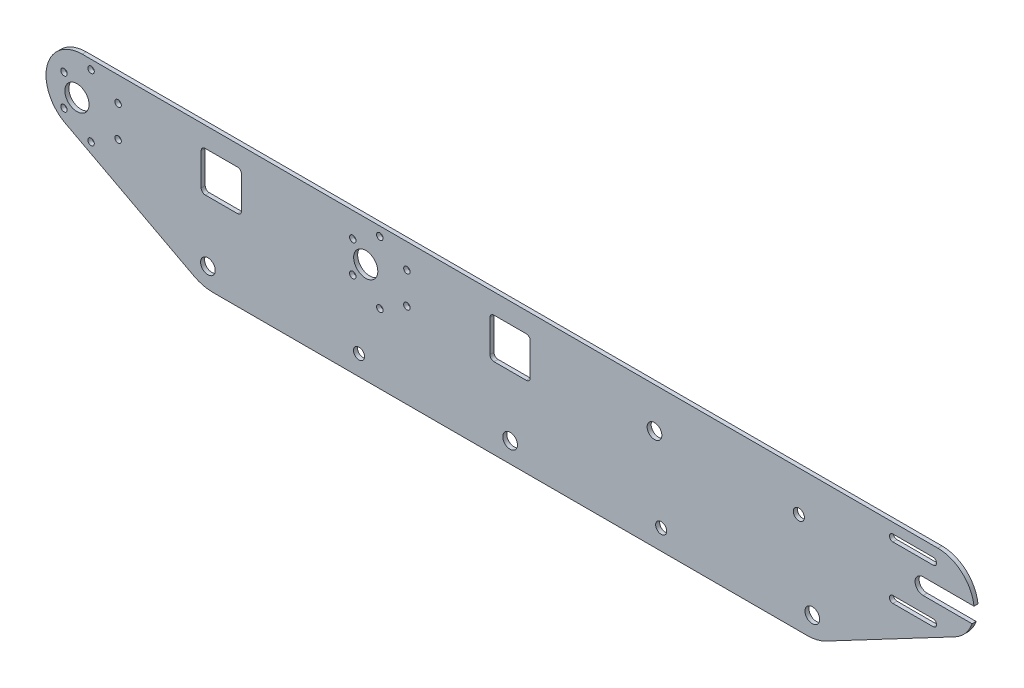
from build123d import *

# Parameters (mm, degrees)
ESQUISSE1_R             = 6
ESQUISSE1_R_2           = 3.65
BOSS_EXTRU_1_DEPTH      = 2
CONG_1_R                = 18
CONG_2_R                = 20
D_GAGEMENT_M32_D        = 3.4
ESQUISSE4_R             = 3.65
ENL_V_MAT_EXTRU_1_DEPTH = 234.819122898
ENL_V_MAT_EXTRU_2_DEPTH = 234.819122898
ESQUISSE8_R             = 1.6
ENL_V_MAT_EXTRU_3_DEPTH = 234.819122898
D_GAGEMENT_M51_D        = 5.5
D_GAGEMENT_M52_D        = 5.5
ESQUISSE13_W            = 20
ESQUISSE13_H            = 20
ENL_V_MAT_EXTRU_4_DEPTH = 234.819122898
CONG_3_R                = 2


with BuildPart() as part:
    # Esquisse1 → Boss.-Extru.1 (new body)
    with BuildSketch(Plane.XY):
        Polygon((-284.958991582, 40), (-247.300009613, 40), (248.333273954, 40), (284.958991582, 40), (248.333273954, 20.647569508), (152.479495791, -30), (-152.479495791, -30), (-247.300009613, 20.10160952), align=None)
        with Locations((-215, 20)):
            Circle(ESQUISSE1_R, mode=Mode.SUBTRACT)
        with Locations((-150, -20)):
            Circle(ESQUISSE1_R_2, mode=Mode.SUBTRACT)
        with Locations((150, -20)):
            Circle(ESQUISSE1_R_2, mode=Mode.SUBTRACT)
        with Locations((215, 20)):
            Circle(ESQUISSE1_R_2, mode=Mode.SUBTRACT)
        with Locations((0, -20)):
            Circle(ESQUISSE1_R_2, mode=Mode.SUBTRACT)
        with Locations((-71.666666667, 20)):
            Circle(ESQUISSE1_R, mode=Mode.SUBTRACT)
        with Locations((71.666666667, 20)):
            Circle(ESQUISSE1_R_2, mode=Mode.SUBTRACT)
    extrude(amount=BOSS_EXTRU_1_DEPTH)

    # Congé1
    cong_1_edges = [part.edges().sort_by_distance(p)[0] for p in [
        (-284.958991582, 40, 1),
        (284.958991582, 40, 1),
    ]]
    fillet(cong_1_edges, radius=CONG_1_R)

    # Congé2
    cong_2_edges = [part.edges().sort_by_distance(p)[0] for p in [
        (-152.479495791, -30, 1),
        (152.479495791, -30, 1),
    ]]
    fillet(cong_2_edges, radius=CONG_2_R)

    # Dégagement M32 (through all)
    with Locations(Plane(origin=(0, 0, 0), x_dir=(-1, 0, 0), z_dir=(0, 0, -1))):
        with Locations((-200, 33.228756555), (-200, 6.771243445)):
            Hole(D_GAGEMENT_M32_D / 2)

    # Esquisse4 → Enlèv. mat.-Extru.1 (cut, through all)
    with BuildSketch(Plane(origin=(0, 0, 0), x_dir=(-1, 0, 0), z_dir=(0, 0, -1))):
        with BuildLine():
            Line((-229.334149786, 16), (-205, 16))
            ThreePointArc((-205, 16), (-201, 20), (-205, 24))
            Line((-205, 24), (-230.252130857, 24))
            ThreePointArc((-230.252130857, 24), (-230.246241418, 19.948007721), (-229.334149786, 16))
        make_face()
        with Locations((-215, 20)):
            Circle(ESQUISSE4_R, mode=Mode.SUBTRACT)
    extrude(amount=-ENL_V_MAT_EXTRU_1_DEPTH, mode=Mode.SUBTRACT)

    # Esquisse7 → Enlèv. mat.-Extru.2 (cut, through all)
    with BuildSketch(Plane(origin=(0, 0, 0), x_dir=(-1, 0, 0), z_dir=(0, 0, -1))):
        with BuildLine():
            ThreePointArc((-200, 31.528756555), (-201.7, 33.228756555), (-200, 34.928756555))
            Line((-200, 34.928756555), (-210, 34.928756555))
            ThreePointArc((-210, 34.928756555), (-211.7, 33.228756555), (-210, 31.528756555))
            Line((-210, 31.528756555), (-200, 31.528756555))
        make_face()
        with BuildLine():
            Line((-190, 34.928756555), (-200, 34.928756555))
            ThreePointArc((-200, 34.928756555), (-198.3, 33.228756555), (-200, 31.528756555))
            Line((-200, 31.528756555), (-190, 31.528756555))
            ThreePointArc((-190, 31.528756555), (-188.3, 33.228756555), (-190, 34.928756555))
        make_face()
        with BuildLine():
            ThreePointArc((-200, 5.071243445), (-201.7, 6.771243445), (-200, 8.471243445))
            Line((-200, 8.471243445), (-210, 8.471243445))
            ThreePointArc((-210, 8.471243445), (-211.7, 6.771243445), (-210, 5.071243445))
            Line((-210, 5.071243445), (-200, 5.071243445))
        make_face()
        with BuildLine():
            Line((-190, 8.471243445), (-200, 8.471243445))
            ThreePointArc((-200, 8.471243445), (-198.3, 6.771243445), (-200, 5.071243445))
            Line((-200, 5.071243445), (-190, 5.071243445))
            ThreePointArc((-190, 5.071243445), (-188.3, 6.771243445), (-190, 8.471243445))
        make_face()
    extrude(amount=-ENL_V_MAT_EXTRU_2_DEPTH, mode=Mode.SUBTRACT)

    # Esquisse8 → Enlèv. mat.-Extru.3 (cut, through all)
    with BuildSketch(Plane(origin=(0, 0, 0), x_dir=(-1, 0, 0), z_dir=(0, 0, -1))):
        with Locations((208, 35.5)):
            Circle(ESQUISSE8_R)
        with Locations((194.576606241, 27.75)):
            Circle(ESQUISSE8_R)
        with Locations((194.576606241, 12.25)):
            Circle(ESQUISSE8_R)
        with Locations((208, 4.5)):
            Circle(ESQUISSE8_R)
        with Locations((221.423393759, 12.25)):
            Circle(ESQUISSE8_R)
        with Locations((221.423393759, 27.75)):
            Circle(ESQUISSE8_R)
        with Locations((64.666666667, 35.5)):
            Circle(ESQUISSE8_R)
        with Locations((51.243272908, 27.75)):
            Circle(ESQUISSE8_R)
        with Locations((51.243272908, 12.25)):
            Circle(ESQUISSE8_R)
        with Locations((64.666666667, 4.5)):
            Circle(ESQUISSE8_R)
        with Locations((78.090060425, 12.25)):
            Circle(ESQUISSE8_R)
        with Locations((78.090060425, 27.75)):
            Circle(ESQUISSE8_R)
    extrude(amount=-ENL_V_MAT_EXTRU_3_DEPTH, mode=Mode.SUBTRACT)

    # Dégagement M51 (through all)
    with Locations(Plane(origin=(0, 0, 0), x_dir=(-1, 0, 0), z_dir=(0, 0, -1))):
        with Locations((143.333333333, 20), (0, 20), (-143.333333333, 20)):
            Hole(D_GAGEMENT_M51_D / 2)

    # Dégagement M52 (through all)
    with Locations(Plane.XY.offset(2)):
        with Locations((-75, -20), (75, -20)):
            Hole(D_GAGEMENT_M52_D / 2)

    # Esquisse13 → Enlèv. mat.-Extru.4 (cut, through all)
    with BuildSketch(Plane.XY.offset(2)):
        with Locations((-143.333333333, 20)):
            Rectangle(ESQUISSE13_W, ESQUISSE13_H)
        with Locations((0, 20)):
            Rectangle(ESQUISSE13_W, ESQUISSE13_H)
    extrude(amount=-ENL_V_MAT_EXTRU_4_DEPTH, mode=Mode.SUBTRACT)

    # Congé3
    cong_3_edges = [part.edges().sort_by_distance(p)[0] for p in [
        (10, 30, 1),
        (-10, 30, 1),
        (-10, 10, 1),
        (10, 10, 1),
        (-133.333333333, 10, 1),
        (-153.333333333, 10, 1),
        (-133.333333333, 30, 1),
        (-153.333333333, 30, 1),
    ]]
    fillet(cong_3_edges, radius=CONG_3_R)


solid = part.part
